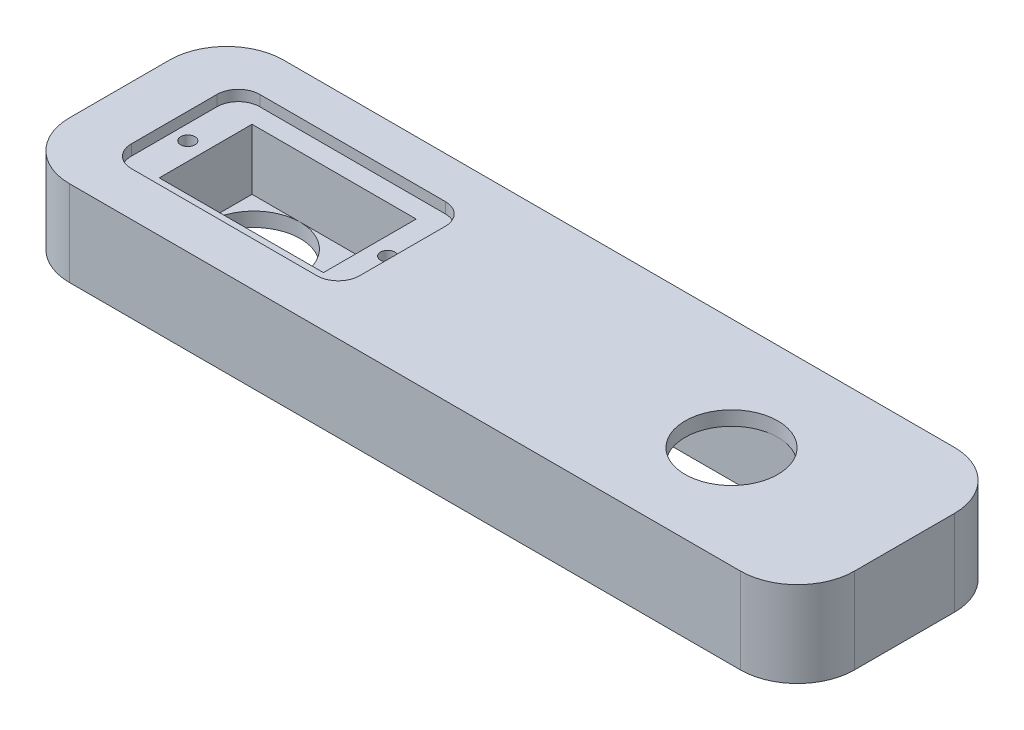
from build123d import *

# Parameters (mm, degrees)
SKETCH1_W           = 110
SKETCH1_H           = 30
BOSS_EXTRUDE1_DEPTH = 12
FILLET2_R           = 8
SKETCH4_R           = 6.5
CUT_EXTRUDE1_DEPTH  = 67.870108383
SKETCH3_W           = 23
SKETCH3_H           = 13
CUT_EXTRUDE2_DEPTH  = 10
SKETCH5_W           = 32
SKETCH5_H           = 18
CUT_EXTRUDE3_DEPTH  = 1.5
FILLET4_R           = 3
SKETCH8_R           = 6.5
CUT_EXTRUDE4_DEPTH  = 63.574437799
SKETCH10_W          = 23
SKETCH10_H          = 13
CUT_EXTRUDE5_DEPTH  = 10
SKETCH12_W          = 32
SKETCH12_H          = 18
CUT_EXTRUDE6_DEPTH  = 1.5
FILLET5_R           = 3
SKETCH14_R          = 1
CUT_EXTRUDE7_DEPTH  = 4
SKETCH6_R           = 1
CUT_EXTRUDE8_DEPTH  = 5


with BuildPart() as part:
    # Sketch1 → Boss-Extrude1 (new body)
    with BuildSketch(Plane(origin=(0, 0, 0), x_dir=(1, 0, 0), z_dir=(0, 1, 0))):
        with Locations((8.243243243, 3.108108108)):
            Rectangle(SKETCH1_W, SKETCH1_H)
    extrude(amount=BOSS_EXTRUDE1_DEPTH)

    # Fillet2
    fillet2_edges = [part.edges().sort_by_distance(p)[0] for p in [
        (63.243243243, 6, -18.108108108),
        (63.243243243, 6, 11.891891892),
        (-46.756756757, 6, -18.108108108),
        (-46.756756757, 6, 11.891891892),
    ]]
    fillet(fillet2_edges, radius=FILLET2_R)

    # Sketch4 → Cut-Extrude1 (cut, through all)
    with BuildSketch(Plane(origin=(0, 12, 0), x_dir=(1, 0, 0), z_dir=(0, 1, 0))):
        with Locations((-27.929103529, 3.108108108)):
            Circle(SKETCH4_R)
    extrude(amount=-CUT_EXTRUDE1_DEPTH, mode=Mode.SUBTRACT)

    # Sketch3 → Cut-Extrude2 (cut)
    with BuildSketch(Plane(origin=(0, 12, 0), x_dir=(1, 0, 0), z_dir=(0, 1, 0))):
        with Locations((-23.179103529, 3.108108108)):
            Rectangle(SKETCH3_W, SKETCH3_H)
    extrude(amount=-CUT_EXTRUDE2_DEPTH, mode=Mode.SUBTRACT)

    # Sketch5 → Cut-Extrude3 (cut)
    with BuildSketch(Plane(origin=(0, 12, 0), x_dir=(1, 0, 0), z_dir=(0, 1, 0))):
        with Locations((-23.262280593, 3.273133416)):
            Rectangle(SKETCH5_W, SKETCH5_H)
    extrude(amount=-CUT_EXTRUDE3_DEPTH, mode=Mode.SUBTRACT)

    # Fillet4
    fillet4_edges = [part.edges().sort_by_distance(p)[0] for p in [
        (-39.262280593, 11.25, 5.726866584),
        (-7.262280593, 11.25, 5.726866584),
        (-39.262280593, 11.25, -12.273133416),
        (-7.262280593, 11.25, -12.273133416),
    ]]
    fillet(fillet4_edges, radius=FILLET4_R)

    # Sketch8 → Cut-Extrude4 (cut, through all)
    with BuildSketch(Plane(origin=(11.720616789, 0, 0.652410252), x_dir=(-1, 0, 0), z_dir=(0, -1, 0))):
        with Locations((-27.929103529, 3.108108108)):
            Circle(SKETCH8_R)
    extrude(amount=-CUT_EXTRUDE4_DEPTH, mode=Mode.SUBTRACT)

    # Sketch10 → Cut-Extrude5 (cut)
    with BuildSketch(Plane(origin=(11.720616789, 0, 0.652410252), x_dir=(-1, 0, 0), z_dir=(0, -1, 0))):
        with Locations((-23.179103529, 3.108108108)):
            Rectangle(SKETCH10_W, SKETCH10_H)
    extrude(amount=-CUT_EXTRUDE5_DEPTH, mode=Mode.SUBTRACT)

    # Sketch12 → Cut-Extrude6 (cut)
    with BuildSketch(Plane(origin=(11.720616789, 0, 0.652410252), x_dir=(-1, 0, 0), z_dir=(0, -1, 0))):
        with Locations((-23.262280593, 3.273133416)):
            Rectangle(SKETCH12_W, SKETCH12_H)
    extrude(amount=-CUT_EXTRUDE6_DEPTH, mode=Mode.SUBTRACT)

    # Fillet5
    fillet5_edges = [part.edges().sort_by_distance(p)[0] for p in [
        (50.982897382, 0.75, 6.379276835),
        (18.982897382, 0.75, 6.379276835),
        (50.982897382, 0.75, -11.620723165),
        (18.982897382, 0.75, -11.620723165),
    ]]
    fillet(fillet5_edges, radius=FILLET5_R)

    # Sketch14 → Cut-Extrude7 (cut)
    with BuildSketch(Plane(origin=(11.720616789, 1.5, 0.652410252), x_dir=(-1, 0, 0), z_dir=(0, -1, 0))):
        with Locations((-37.179103529, 3.108108108)):
            Circle(SKETCH14_R)
        with Locations((-9.179103529, 3.108108108)):
            Circle(SKETCH14_R)
    extrude(amount=-CUT_EXTRUDE7_DEPTH, mode=Mode.SUBTRACT)

    # Sketch6 → Cut-Extrude8 (cut)
    with BuildSketch(Plane(origin=(0, 10.5, 0), x_dir=(1, 0, 0), z_dir=(0, 1, 0))):
        with Locations((-37.179103529, 3.108108108)):
            Circle(SKETCH6_R)
        with Locations((-9.179103529, 3.108108108)):
            Circle(SKETCH6_R)
    extrude(amount=-CUT_EXTRUDE8_DEPTH, mode=Mode.SUBTRACT)


solid = part.part
